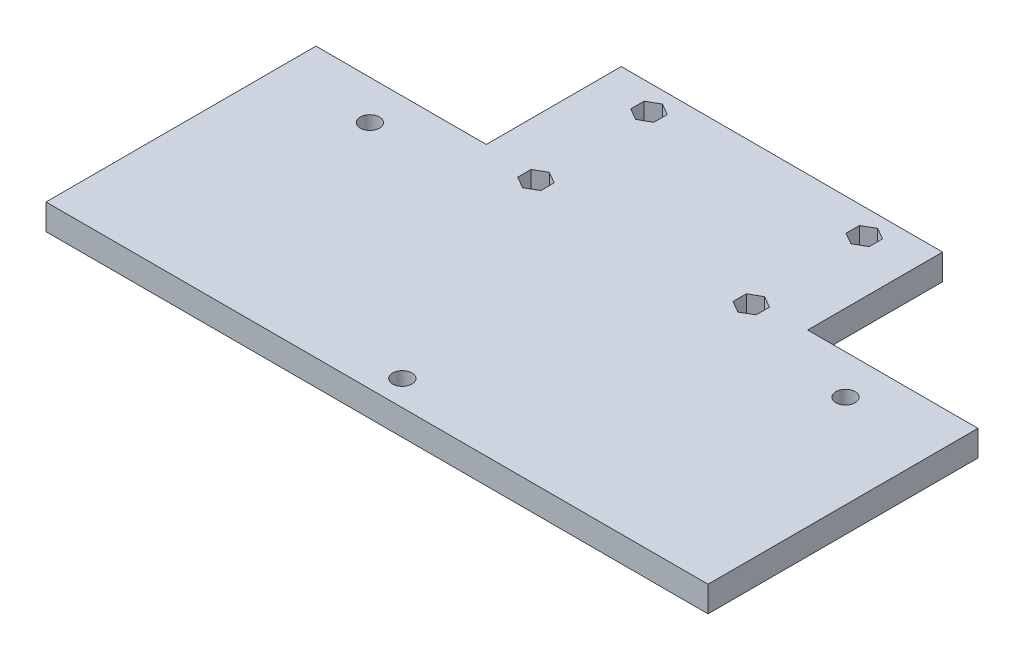
from build123d import *

# Parameters (mm, degrees)
SKETCH1_R           = 1.5
BOSS_EXTRUDE1_DEPTH = 4


with BuildPart() as part:
    # Sketch1 → Boss-Extrude1 (new body)
    with BuildSketch(Plane(origin=(0, 0, 0), x_dir=(1, 0, 0), z_dir=(0, 1, 0))):
        Polygon((-47.617823434, 13.138325982), (-21.117823434, 13.138325982), (-21.117823434, 34.138325982), (28.882176566, 34.138325982), (28.882176566, 13.138325982), (55.382176566, 13.138325982), (55.382176566, -28.861674018), (-47.617823434, -28.861674018), align=None)
        with Locations((-33.117823434, 7.028381098)):
            Circle(SKETCH1_R, mode=Mode.SUBTRACT)
        with Locations((40.882176566, 7.028381098)):
            Circle(SKETCH1_R, mode=Mode.SUBTRACT)
        with Locations((3.882176566, -24.926770137)):
            Circle(SKETCH1_R, mode=Mode.SUBTRACT)
        Polygon((-11.060336408, 31.228872178), (-12.852754771, 32.281125195), (-14.660241797, 31.254971867), (-14.675310459, 29.176565522), (-12.882892096, 28.124312505), (-11.075405071, 29.150465833), align=None, mode=Mode.SUBTRACT)
        Polygon((20.632176566, 28.124257881), (22.432176566, 29.163488365), (22.432176566, 31.241949334), (20.632176566, 32.281179819), (18.832176566, 31.241949334), (18.832176566, 29.163488365), align=None, mode=Mode.SUBTRACT)
        Polygon((-12.465097939, 10.128763662), (-10.665097939, 11.167994147), (-10.665097939, 13.246455116), (-12.465097939, 14.2856856), (-14.265097939, 13.246455116), (-14.265097939, 11.167994147), align=None, mode=Mode.SUBTRACT)
        Polygon((21.034902061, 10.128763662), (22.834902061, 11.167994147), (22.834902061, 13.246455116), (21.034902061, 14.2856856), (19.234902061, 13.246455116), (19.234902061, 11.167994147), align=None, mode=Mode.SUBTRACT)
    extrude(amount=BOSS_EXTRUDE1_DEPTH)


solid = part.part
